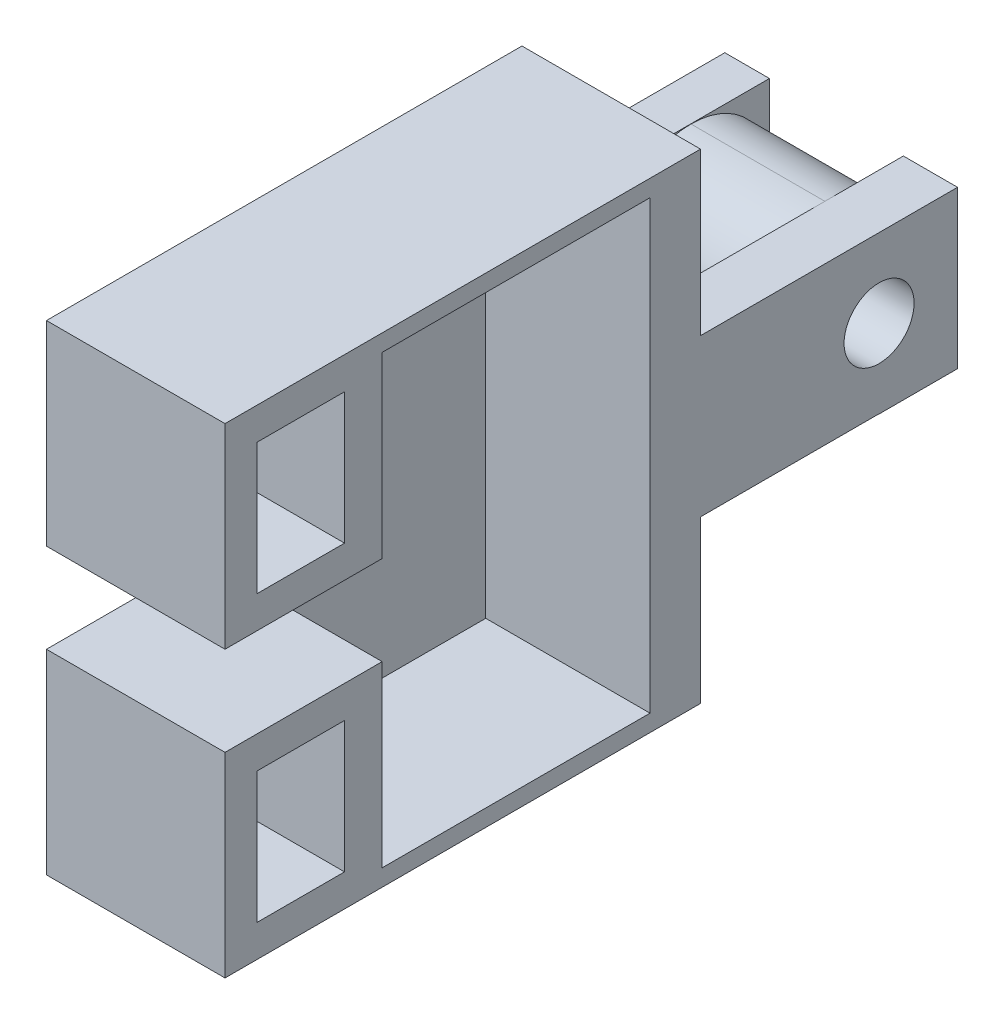
from build123d import *

# Parameters (mm, degrees)
FEATURE_B_DEPTH      = 7.706067936
FEATURE_START        = 25.4
SKETCH3_R            = 11.162804955
FEATURE_A_DEPTH      = 25.4
SKETCH5_W            = 65.757777778
SKETCH5_H            = 7.184204897
FEATURE_C_DEPTH      = 25.4
SKETCH6_W            = 25.4
SKETCH6_H            = 1.128888889
FEATURE_D_DEPTH      = 38.1
SKETCH8_W            = 25.4
SKETCH8_H            = 26.528888889
BOSS_EXTRUDE5_DEPTH  = 22.354838115
SKETCH35_W           = 25.4
SKETCH35_H           = 67.639043011
BOSS_EXTRUDE14_DEPTH = 1.27
SKETCH37_W           = 25.4
SKETCH37_H           = 67.639043011
BOSS_EXTRUDE15_DEPTH = 1.27
SKETCH42_W           = 63.5
SKETCH42_H           = 38.1
BOSS_EXTRUDE17_DEPTH = 2.032
CUT_EXTRUDE8_REACH   = 108.558
SKETCH47_W           = 18.654888889
SKETCH47_H           = 12.432391234
SKETCH47_W_2         = 7.62
SKETCH47_H_2         = 5.713389052
SKETCH58_W           = 7.706067936
SKETCH58_H           = 11.162804955
BOSS_EXTRUDE25_DEPTH = 22.352
BOSS_EXTRUDE27_DEPTH = 22.352
CUT_EXTRUDE12_REACH  = 110.653
SKETCH61_R           = 4.97881046


with BuildPart() as part:
    # Sketch1 → Feature B (new body)
    with BuildSketch(Plane.YZ):
        with BuildLine():
            Line((0, 0), (0, 25.4))
            Line((0, 25.4), (22.32560991, 25.4))
            Line((22.32560991, 25.4), (22.32560991, 0))
            ThreePointArc((22.32560991, 0), (11.162804955, -11.162804955), (0, 0))
        make_face()
    extrude(amount=FEATURE_B_DEPTH)

    # Sketch3 → Feature A (add)
    with BuildSketch(Plane(origin=(0, 0, 0), x_dir=(0, -1, 0), z_dir=(-1, 0, 0)).offset(FEATURE_START)):
        with Locations((-11.162804955, 0)):
            Circle(SKETCH3_R)
    extrude(amount=-FEATURE_A_DEPTH)

    # Sketch5 → Feature C (add)
    with BuildSketch(Plane.YZ.offset(7.706067936)):
        with Locations((11.162804955, 28.992102448)):
            Rectangle(SKETCH5_W, SKETCH5_H)
    extrude(amount=-FEATURE_C_DEPTH)

    # Sketch6 → Feature D (add)
    with BuildSketch(Plane.XY.offset(32.584204897)):
        with Locations((-4.993932064, -21.151639489)):
            Rectangle(SKETCH6_W, SKETCH6_H)
        with Locations((-4.993932064, 43.4772494)):
            Rectangle(SKETCH6_W, SKETCH6_H)
    extrude(amount=FEATURE_D_DEPTH)

    # Sketch8 → Boss-Extrude5 (add)
    with BuildSketch(Plane.XY.offset(70.684204897)):
        with Locations((-4.993932064, -8.451639489)):
            Rectangle(SKETCH8_W, SKETCH8_H)
        with Locations((-4.993932064, 30.7772494)):
            Rectangle(SKETCH8_W, SKETCH8_H)
    extrude(amount=BOSS_EXTRUDE5_DEPTH)

    # Sketch35 → Boss-Extrude14 (add)
    with BuildSketch(Plane(origin=(0, 44.041693844, 0), x_dir=(-1, 0, 0), z_dir=(0, 1, 0))):
        with Locations((4.993932064, 59.219521506)):
            Rectangle(SKETCH35_W, SKETCH35_H)
    extrude(amount=BOSS_EXTRUDE14_DEPTH)

    # Sketch37 → Boss-Extrude15 (add)
    with BuildSketch(Plane.XZ.offset(21.716083934)):
        with Locations((-4.993932064, 59.219521506)):
            Rectangle(SKETCH37_W, SKETCH37_H)
    extrude(amount=BOSS_EXTRUDE15_DEPTH)

    # Sketch42 → Boss-Extrude17 (add)
    with BuildSketch(Plane(origin=(-17.693932064, 0, 0), x_dir=(0, -1, 0), z_dir=(-1, 0, 0))):
        with Locations((-11.162804955, 51.634204897)):
            Rectangle(SKETCH42_W, SKETCH42_H)
    extrude(amount=-BOSS_EXTRUDE17_DEPTH)

    # Sketch47 → Cut-Extrude8 (cut, up to next)
    with BuildSketch(Plane(origin=(-17.693932064, 0, 0), x_dir=(0, -1, 0), z_dir=(-1, 0, 0)), mode=Mode.PRIVATE) as cut_extrude8_sk1:
        with Locations((-31.4122494, 82.250847394)):
            Rectangle(SKETCH47_W, SKETCH47_H)
    cut_extrude8_tool1 = extrude(cut_extrude8_sk1.sketch, amount=-CUT_EXTRUDE8_REACH, mode=Mode.PRIVATE) & part.part
    # Sketch47 → Cut-Extrude8 (cut, up to next)
    with BuildSketch(Plane(origin=(-17.693932064, 0, 0), x_dir=(0, -1, 0), z_dir=(-1, 0, 0)), mode=Mode.PRIVATE) as cut_extrude8_sk2:
        with Locations((9.086639489, 82.250847394)):
            Rectangle(SKETCH47_W, SKETCH47_H)
    cut_extrude8_tool2 = extrude(cut_extrude8_sk2.sketch, amount=-CUT_EXTRUDE8_REACH, mode=Mode.PRIVATE) & part.part
    # Sketch47 → Cut-Extrude8 (cut, up to next)
    with BuildSketch(Plane(origin=(-17.693932064, 0, 0), x_dir=(0, -1, 0), z_dir=(-1, 0, 0)), mode=Mode.PRIVATE) as cut_extrude8_sk3:
        with Locations((-11.162804955, 63.710055393)):
            Rectangle(SKETCH47_W_2, SKETCH47_H_2)
    cut_extrude8_tool3 = extrude(cut_extrude8_sk3.sketch, amount=-CUT_EXTRUDE8_REACH, mode=Mode.PRIVATE) & part.part
    add(cut_extrude8_tool1.solids().sort_by_distance((-17.693932, 31.412249, 82.250847))[0], mode=Mode.SUBTRACT)
    add(cut_extrude8_tool2.solids().sort_by_distance((-17.693932, -9.086639, 82.250847))[0], mode=Mode.SUBTRACT)
    add(cut_extrude8_tool3.solids().sort_by_distance((-17.693932, 11.162805, 63.710055))[0], mode=Mode.SUBTRACT)

    # Sketch58 → Boss-Extrude25 (add)
    with BuildSketch(Plane(origin=(0, 22.32560991, 0), x_dir=(-1, 0, 0), z_dir=(0, 1, 0))):
        with Locations((-3.853033968, -5.581402478)):
            Rectangle(SKETCH58_W, SKETCH58_H)
    extrude(amount=-BOSS_EXTRUDE25_DEPTH)

    # Sketch60 → Boss-Extrude27 (add)
    with BuildSketch(Plane.XZ):
        Polygon((-17.693932064, 25.4), (-25.4, 11.176), (-25.4, -11.162804955), (-19.050013709, -11.162804955), (-19.050013709, 11.162804955), (-11.343932064, 25.4), align=None)
    extrude(amount=-BOSS_EXTRUDE27_DEPTH)

    # Sketch61 → Cut-Extrude12 (cut, up to next)
    with BuildSketch(Plane(origin=(-25.4, 0, 0), x_dir=(0, -1, 0), z_dir=(-1, 0, 0)), mode=Mode.PRIVATE) as cut_extrude12_sk1:
        with Locations((-11.162804955, 0)):
            Circle(SKETCH61_R)
    cut_extrude12_tool1 = extrude(cut_extrude12_sk1.sketch, amount=-CUT_EXTRUDE12_REACH, mode=Mode.PRIVATE) & part.part
    add(cut_extrude12_tool1.solids().sort_by_distance((-25.4, 11.162805, 0))[0], mode=Mode.SUBTRACT)


solid = part.part
